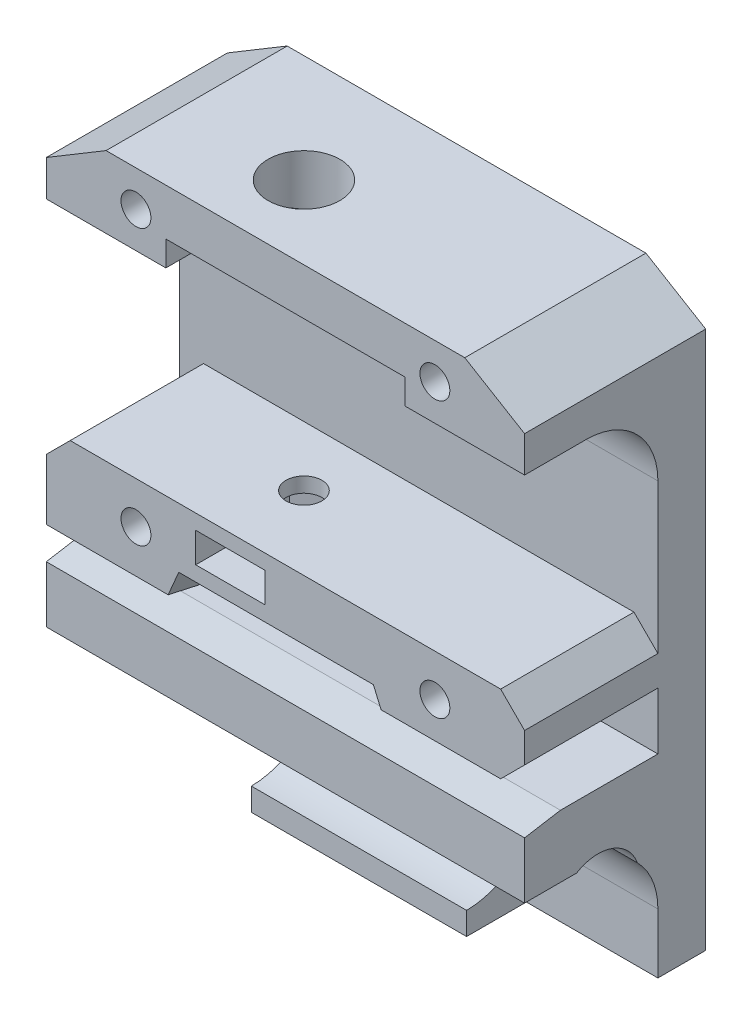
from build123d import *

# Parameters (mm, degrees)
SKETCH1_W                = 40
SKETCH1_H                = 48
BOSS_EXTRUDE1_DEPTH      = 4
BOSS_EXTRUDE2_DEPTH      = 11.15
BOSS_EXTRUDE2_DEPTH_BACK = 4
SKETCH5_W                = 40
SKETCH5_H                = 5.225
SKETCH5_W_2              = 18
SKETCH5_H_2              = 5
SKETCH5_H_3              = 6
FILLET1_DEPTH            = 40
SKETCH6_R                = 1.25
CUT_EXTRUDE4_DEPTH       = 58.214705278
CHAMFER2_SIZE            = 2
CHAMFER3_SIZE            = 3
CHAMFER3_SIZE2           = 1
CHAMFER4_SIZE            = 3
CHAMFER4_SIZE2           = 0.5
CUT_EXTRUDE6_DEPTH       = 10
CUT_EXTRUDE6_DEPTH_BACK  = 10
CUT_EXTRUDE8_REACH       = 66.292
SKETCH12_R               = 3
SKETCH13_R               = 1.5
CUT_EXTRUDE10_DEPTH      = 10.275
CUT_EXTRUDE7_DEPTH       = 1.25
CUT_EXTRUDE7_DEPTH_BACK  = 1.25
CHAMFER5_SIZE            = 5
CHAMFER5_SIZE2           = 3
CHAMFER6_SIZE            = 3
CHAMFER6_SIZE2           = 5
CUT_EXTRUDE12_DEPTH      = 46.535947422
CUT_EXTRUDE12_DEPTH_BACK = 46.535947422
SKETCH15_R               = 3.5


with BuildPart() as part:
    # Sketch1 → Boss-Extrude1 (new body)
    with BuildSketch(Plane.XY):
        with Locations((20, 14)):
            Rectangle(SKETCH1_W, SKETCH1_H)
    extrude(amount=BOSS_EXTRUDE1_DEPTH)

    # Sketch5 → Boss-Extrude2 (add, two sides: drawn at the far end of the back side and taken through both)
    with BuildSketch(Plane.XY.offset(4).offset(-BOSS_EXTRUDE2_DEPTH_BACK)):
        Polygon((0.9, 8.125), (0, 8.125), (0, 15.5), (40, 15.5), (40, 9), (28, 9), (27.357142857, 10.5), (11.081237185, 10.5), (9.763380042, 7.425), (8.800403155, 7.425), (8.500403155, 8.125), (7.531690021, 8.125), (7.231690021, 7.425), (6.221941609, 7.425), (5.921941609, 8.125), (5, 8.125), (4.7, 7.425), (3.7, 7.425), (3.4, 8.125), (2.5, 8.125), (2.2, 7.425), (1.2, 7.425), align=None)
        with Locations((20, 3.6125)):
            Rectangle(SKETCH5_W, SKETCH5_H)
        with Locations((20, -7.5)):
            Rectangle(SKETCH5_W_2, SKETCH5_H_2)
        with Locations((20, 35)):
            Rectangle(SKETCH5_W, SKETCH5_H_3)
    extrude(amount=BOSS_EXTRUDE2_DEPTH + BOSS_EXTRUDE2_DEPTH_BACK)

    # Fillet1: read off the stored shape, not the designer's step
    # Fillet1 outline → Fillet1 (add)
    with BuildSketch(Plane.YZ):
        with BuildLine():
            Line((32, 4), (32, 10))
            ThreePointArc((32, 10), (30.242640687, 5.757359313), (26, 4))
            Line((26, 4), (32, 4))
        make_face()
        with BuildLine():
            Line((1, 4), (1, 10))
            ThreePointArc((1, 10), (-0.757359313, 5.757359313), (-5, 4))
            Line((-5, 4), (1, 4))
        make_face()
    extrude(amount=FILLET1_DEPTH)

    # Sketch6 → Cut-Extrude4 (cut, through all)
    with BuildSketch(Plane.XY.offset(15.15)):
        with Locations((7.5, 35)):
            Circle(SKETCH6_R)
        with Locations((7.5, 12)):
            Circle(SKETCH6_R)
        with Locations((32.5, 35)):
            Circle(SKETCH6_R)
        with Locations((32.5, 12)):
            Circle(SKETCH6_R)
    extrude(amount=-CUT_EXTRUDE4_DEPTH, mode=Mode.SUBTRACT)

    # Chamfer2
    chamfer2_edges = [part.edges().sort_by_distance(p)[0] for p in [
        (40, 9, 9.575),
        (0, 15.5, 9.575),
        (40, 15.5, 9.575),
    ]]
    chamfer(chamfer2_edges, length=CHAMFER2_SIZE)

    # Chamfer3
    chamfer3_edges = [part.edges().sort_by_distance(p)[0] for p in [
        (4.2, 7.425, 15.15),
    ]]
    chamfer3_side = [part.faces().sort_by_distance(p)[0] for p in [
        (4.2, 7.425, 9.575),
    ]]
    chamfer(chamfer3_edges, length=CHAMFER3_SIZE, length2=CHAMFER3_SIZE2, reference=chamfer3_side[0])

    # Chamfer4
    chamfer4_edges = [part.edges().sort_by_distance(p)[0] for p in [
        (20, 6.225, 15.15),
    ]]
    chamfer4_side = [part.faces().sort_by_distance(p)[0] for p in [
        (20, 6.225, 9.575),
    ]]
    chamfer(chamfer4_edges, length=CHAMFER4_SIZE, length2=CHAMFER4_SIZE2, reference=chamfer4_side[0])

    # Sketch8 → Cut-Extrude6 (cut, two sides: drawn at the far end of the back side and taken through both)
    with BuildSketch(Plane(origin=(20, 0, 0), x_dir=(0, 0, -1), z_dir=(1, 0, 0)).offset(-CUT_EXTRUDE6_DEPTH_BACK)):
        with BuildLine():
            Line((-9, 34.1), (-18.820916768, 34.1))
            Line((-18.820916768, 34.1), (-18.820916768, 21.9))
            Line((-18.820916768, 21.9), (-9, 21.9))
            ThreePointArc((-9, 21.9), (-2.9, 28), (-9, 34.1))
        make_face()
        with BuildLine():
            Line((-18.820916768, -10.472551988), (-18.820916768, -3.194214037))
            Line((-18.820916768, -3.194214037), (-13.313351365, 2.313351365))
            ThreePointArc((-13.313351365, 2.313351365), (-3.364334852, 0.334368937), (-9, -8.1))
            Line((-9, -8.1), (-9, -10.472551988))
            Line((-9, -10.472551988), (-18.820916768, -10.472551988))
        make_face()
    extrude(amount=CUT_EXTRUDE6_DEPTH + CUT_EXTRUDE6_DEPTH_BACK, mode=Mode.SUBTRACT)

    # Cut-Extrude8: up to this face of the body (flat: up to its plane)
    cut_extrude8_end = Plane(part.part.faces().sort_by_distance((20, 15.5, 9.575))[0])
    # Sketch12 → Cut-Extrude8 (cut, up to the picked face)
    with BuildSketch(Plane(origin=(0, 38, 0), x_dir=(1, 0, 0), z_dir=(0, 1, 0)), mode=Mode.PRIVATE) as cut_extrude8_sk1:
        with Locations(Location((15.4, -9, 0), (0, 0, 270))):
            Circle(SKETCH12_R)
    cut_extrude8_tool1 = split(extrude(cut_extrude8_sk1.sketch, amount=-CUT_EXTRUDE8_REACH, mode=Mode.PRIVATE), bisect_by=cut_extrude8_end, keep=Keep.BOTH, mode=Mode.PRIVATE)
    add(cut_extrude8_tool1.solids().sort_by(Axis((15.4, 38, 9), (0, -1, 0)))[0], mode=Mode.SUBTRACT)

    # Sketch13 → Cut-Extrude10 (cut)
    with BuildSketch(Plane(origin=(0, 15.5, 0), x_dir=(1, 0, 0), z_dir=(0, 1, 0))):
        with Locations(Location((15.4, -9, 0), (0, 0, 180))):
            Circle(SKETCH13_R)
    extrude(amount=-CUT_EXTRUDE10_DEPTH, mode=Mode.SUBTRACT)

    # Sketch9 → Cut-Extrude7 (cut, two sides: drawn at the far end of the back side and taken through both)
    with BuildSketch(Plane.XZ.offset(-13).offset(-CUT_EXTRUDE7_DEPTH_BACK)):
        Polygon((12.5, 16.815347994), (18.3, 16.815347994), (18.3, 7.325684219), (15.4, 5.651368439), (12.5, 7.325684219), align=None)
    extrude(amount=CUT_EXTRUDE7_DEPTH + CUT_EXTRUDE7_DEPTH_BACK, mode=Mode.SUBTRACT)

    # Chamfer5
    chamfer5_edges = [part.edges().sort_by_distance(p)[0] for p in [
        (0, 38, 7.575),
    ]]
    chamfer5_side = [part.faces().sort_by_distance(p)[0] for p in [
        (20.225127502, 38, 7.505259415),
    ]]
    chamfer(chamfer5_edges, length=CHAMFER5_SIZE, length2=CHAMFER5_SIZE2, reference=chamfer5_side[0])

    # Chamfer6
    chamfer6_edges = [part.edges().sort_by_distance(p)[0] for p in [
        (40, 38, 7.575),
    ]]
    chamfer6_side = [part.faces().sort_by_distance(p)[0] for p in [
        (40, 5.721658913, 8.075),
    ]]
    chamfer(chamfer6_edges, length=CHAMFER6_SIZE, length2=CHAMFER6_SIZE2, reference=chamfer6_side[0])

    # Sketch15 → Cut-Extrude12 (cut, two sides: drawn at the far end of the back side and taken through both)
    with BuildSketch(Plane(origin=(20, 0, 0), x_dir=(0, 0, -1), z_dir=(1, 0, 0)).offset(-CUT_EXTRUDE12_DEPTH_BACK)):
        with Locations((-9, -2)):
            Circle(SKETCH15_R)
    extrude(amount=CUT_EXTRUDE12_DEPTH + CUT_EXTRUDE12_DEPTH_BACK, mode=Mode.SUBTRACT)


solid = part.part
